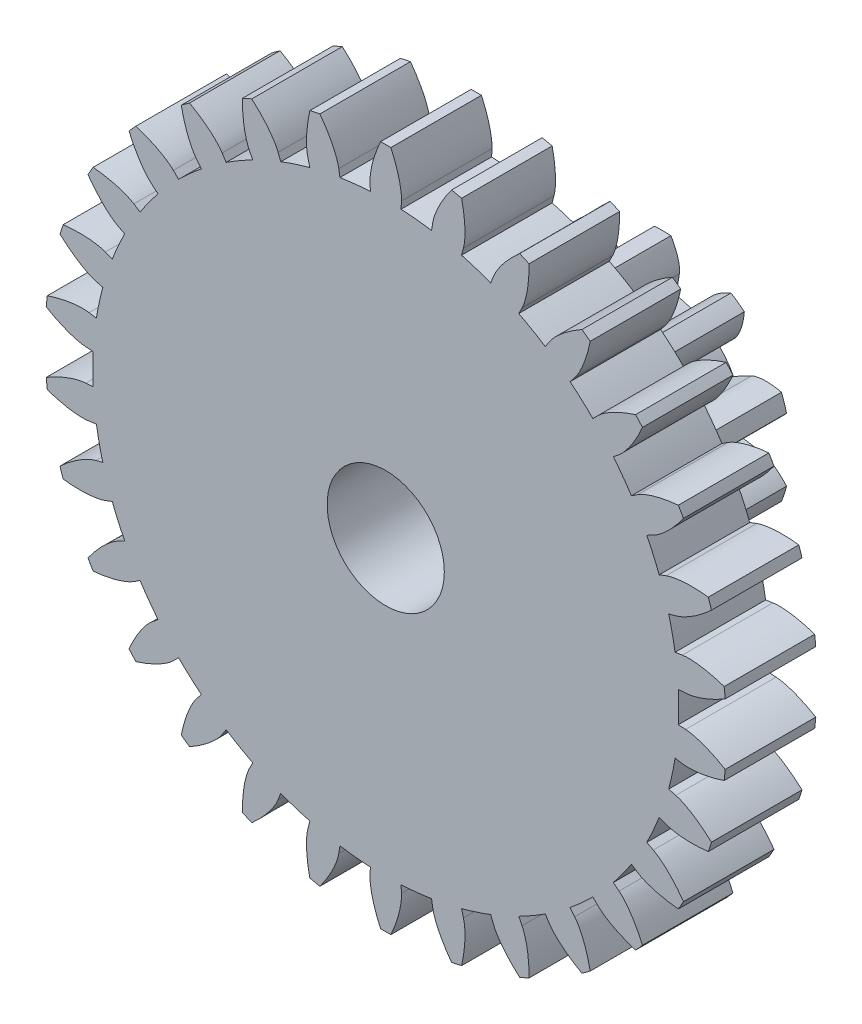
from build123d import *

# Parameters (mm, degrees)
SKETCH_1_R               = 2.4
SKETCH_1_R_2             = 1.1
EXTRUDE_1_DEPTH          = 3.5
CUT_EXTRUDE_1_DEPTH      = 5.875448697
PATTERN_CIRCULAR_1_COUNT = 10
PATTERN_CIRCULAR_1_ANGLE = 324
SKETCH_2_R               = 6.4
SKETCH_2_R_2             = 1.1
EXTRUDE_2_DEPTH          = 1.7
CUT_EXTRUDE_3_DEPTH      = 10.704123003
PATTERN_CIRCULAR_2_COUNT = 30


with BuildPart() as part:
    # 草图1 → 凸台-拉伸1 (new body)
    with BuildSketch(Plane.XY):
        Circle(SKETCH_1_R)
        Circle(SKETCH_1_R_2, mode=Mode.SUBTRACT)
    extrude(amount=EXTRUDE_1_DEPTH)

    # 草图1<3> → 切除-拉伸1 (cut, through all)
    with BuildSketch(Plane.XY):
        with BuildLine():
            Line((1.859235395, 0.274467909), (1.483917736, 0.219061986))
            ThreePointArc((1.483917736, 0.219061986), (1.495974031, 0.109825763), (1.5, 0))
            ThreePointArc((1.5, 0), (1.495974031, -0.109825763), (1.483917736, -0.219061986))
            Line((1.483917736, -0.219061986), (1.859235395, -0.274467909))
            add(Edge.make_bspline(
                [(1.859235395, -0.274467909), (1.873407843, -0.276560104), (1.912523682, -0.285344282), (1.984002679, -0.313654938), (2.0924461, -0.374994999), (2.194274435, -0.455780102), (2.268051859, -0.528692544), (2.312811244, -0.578880732), (2.325443939, -0.593557483)],
                knots=[0, 0, 0, 0, 0, 0.005604068, 0.015718248, 0.029959916, 0.048733667, 0.056327554, 0.056327554, 0.056327554, 0.056327554, 0.056327554], degree=4))
            ThreePointArc((2.325443939, -0.593557483), (2.381288039, -0.299110804), (2.4, 0))
            ThreePointArc((2.4, 0), (2.381288039, 0.299110804), (2.325443939, 0.593557483))
            add(Edge.make_bspline(
                [(1.859235395, 0.274467909), (1.873407843, 0.276560104), (1.912523682, 0.285344282), (1.984002679, 0.313654938), (2.0924461, 0.374994999), (2.194274435, 0.455780102), (2.268051859, 0.528692544), (2.312811244, 0.578880732), (2.325443939, 0.593557483)],
                knots=[0, 0, 0, 0, 0, 0.005604068, 0.015718248, 0.029959916, 0.048733667, 0.056327554, 0.056327554, 0.056327554, 0.056327554, 0.056327554], degree=4))
        make_face()
    cut_extrude_1 = extrude(amount=CUT_EXTRUDE_1_DEPTH, mode=Mode.SUBTRACT)

    # 阵列(圆周)1: 切除-拉伸1 ×10 about axis
    pattern_circular_1_axis = Axis((0, 0, 3.5), (0, 0, 1))
    for i in range(1, PATTERN_CIRCULAR_1_COUNT):
        add(cut_extrude_1.rotate(pattern_circular_1_axis, i * PATTERN_CIRCULAR_1_ANGLE / (PATTERN_CIRCULAR_1_COUNT - 1)), mode=Mode.SUBTRACT)

    # 草图2 → 凸台-拉伸2 (add)
    with BuildSketch(Plane.XY.offset(3.5)):
        Circle(SKETCH_2_R)
        Circle(SKETCH_2_R_2, mode=Mode.SUBTRACT)
    extrude(amount=EXTRUDE_2_DEPTH)

    # 草图2<3> → 切除-拉伸3 (cut, through all)
    with BuildSketch(Plane.XY.offset(3.5)):
        with BuildLine():
            Line((5.630428828, 0.295078271), (5.492462441, 0.287847759))
            ThreePointArc((5.492462441, 0.287847759), (5.498115287, 0.143973216), (5.5, 0))
            ThreePointArc((5.5, 0), (5.498115287, -0.143973216), (5.492462441, -0.287847759))
            Line((5.492462441, -0.287847759), (5.630428828, -0.295078271))
            add(Edge.make_bspline(
                [(5.630428828, -0.295078271), (5.651865751, -0.296201733), (5.6945181, -0.30045408), (5.812908276, -0.322863873), (6.004188265, -0.383416301), (6.167526736, -0.456962726), (6.30561421, -0.532368385), (6.374290296, -0.57308221)],
                knots=[0, 0, 0, 0, 0, 0.002802034, 0.005604068, 0.015718248, 0.026152267, 0.026152267, 0.026152267, 0.026152267, 0.026152267], degree=4))
            ThreePointArc((6.374290296, -0.57308221), (6.393569343, -0.286829308), (6.4, 0))
            ThreePointArc((6.4, 0), (6.393569343, 0.286829308), (6.374290296, 0.57308221))
            add(Edge.make_bspline(
                [(5.630428828, 0.295078271), (5.651865751, 0.296201733), (5.6945181, 0.30045408), (5.812908276, 0.322863873), (6.004188265, 0.383416301), (6.167526736, 0.456962726), (6.30561421, 0.532368385), (6.374290296, 0.57308221)],
                knots=[0, 0, 0, 0, 0, 0.002802034, 0.005604068, 0.015718248, 0.026152267, 0.026152267, 0.026152267, 0.026152267, 0.026152267], degree=4))
        make_face()
    cut_extrude_3 = extrude(amount=CUT_EXTRUDE_3_DEPTH, mode=Mode.SUBTRACT)

    # 阵列(圆周)2: 切除-拉伸3 ×30 about axis
    pattern_circular_2_axis = Axis((0, 0, 5.2), (0, 0, 1))
    for i in range(1, PATTERN_CIRCULAR_2_COUNT):
        add(cut_extrude_3.rotate(pattern_circular_2_axis, i * 360 / PATTERN_CIRCULAR_2_COUNT), mode=Mode.SUBTRACT)


solid = part.part
